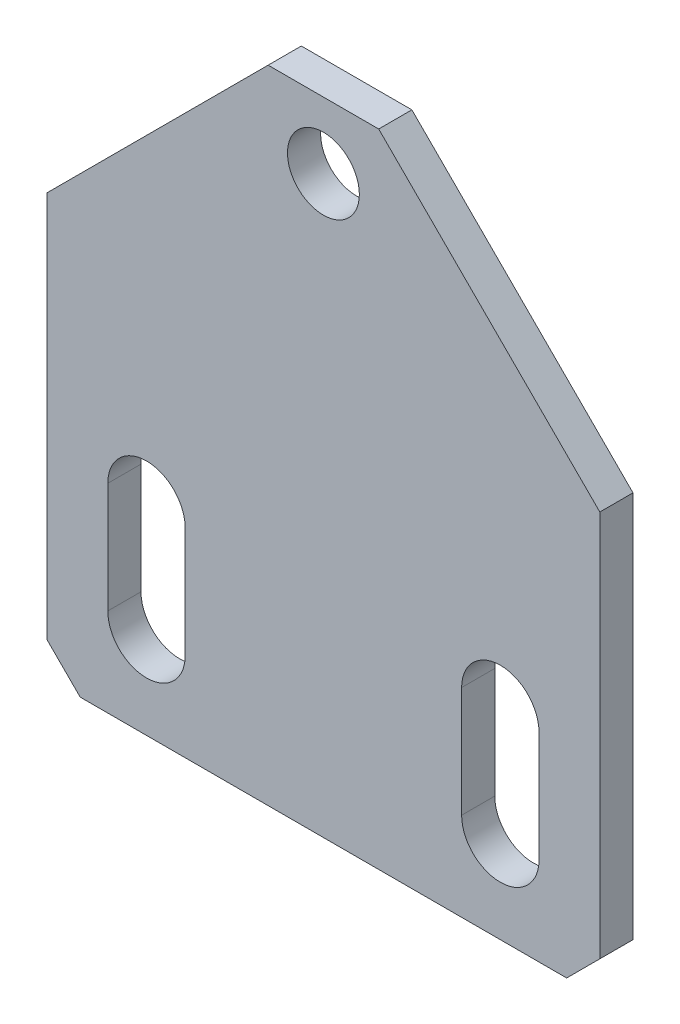
from build123d import *

# Parameters (mm, degrees)
SKETCH_1_W             = 50
SKETCH_1_H             = 58
SM_BASE_FLANGE_1_DEPTH = 3
SKETCH_2_R             = 3.25
CUT_EXTRUDE_1_DEPTH    = 10
HOLE_WIZARD_7_0_7_1_D  = 7
CHAMFER_1_SIZE         = 3
CUT_EXTRUDE_2_DEPTH    = 10
CUT_EXTRUDE_3_DEPTH    = 10


# Sheet-metal steps are written as plain solids
with BuildPart() as part:
    # Sketch 1 → 基体-法兰1 (new body)
    with BuildSketch(Plane.XY):
        Rectangle(SKETCH_1_W, SKETCH_1_H)
    extrude(amount=-SM_BASE_FLANGE_1_DEPTH)

    # Sketch 2 → 切除-拉伸1 (cut)
    with BuildSketch(Plane.XY):
        with Locations((0, 23)):
            Circle(SKETCH_2_R)
    extrude(amount=-CUT_EXTRUDE_1_DEPTH, mode=Mode.SUBTRACT)

    # Ø7.0 (7) 直径孔1 (through all)
    with Locations(Plane.XY):
        with Locations((-16, -11.5), (16, -11.5)):
            Hole(HOLE_WIZARD_7_0_7_1_D / 2)

    # 倒角1
    chamfer_1_edges = [part.edges().sort_by_distance(p)[0] for p in [
        (25, -29, -1.5),
        (-25, -29, -1.5),
    ]]
    chamfer(chamfer_1_edges, length=CHAMFER_1_SIZE)

    # 草图5 → 切除-拉伸2 (cut)
    with BuildSketch(Plane.XY):
        Polygon((-5, 29), (-25, 9), (-25, 29), align=None)
        Polygon((25, 29), (5, 29), (25, 9), align=None)
    extrude(amount=-CUT_EXTRUDE_2_DEPTH, mode=Mode.SUBTRACT)

    # 草图7 → 切除-拉伸3 (cut)
    with BuildSketch(Plane.XY):
        with BuildLine():
            Line((-19.5, -21), (-19.5, -11))
            ThreePointArc((-19.5, -11), (-16, -7.5), (-12.5, -11))
            Line((-12.5, -11), (-12.5, -21))
            ThreePointArc((-12.5, -21), (-16, -24.5), (-19.5, -21))
        make_face()
        with BuildLine():
            Line((12.5, -21), (12.5, -11))
            ThreePointArc((12.5, -11), (16, -7.5), (19.5, -11))
            Line((19.5, -11), (19.5, -21))
            ThreePointArc((19.5, -21), (16, -24.5), (12.5, -21))
        make_face()
    extrude(amount=-CUT_EXTRUDE_3_DEPTH, mode=Mode.SUBTRACT)


solid = part.part
